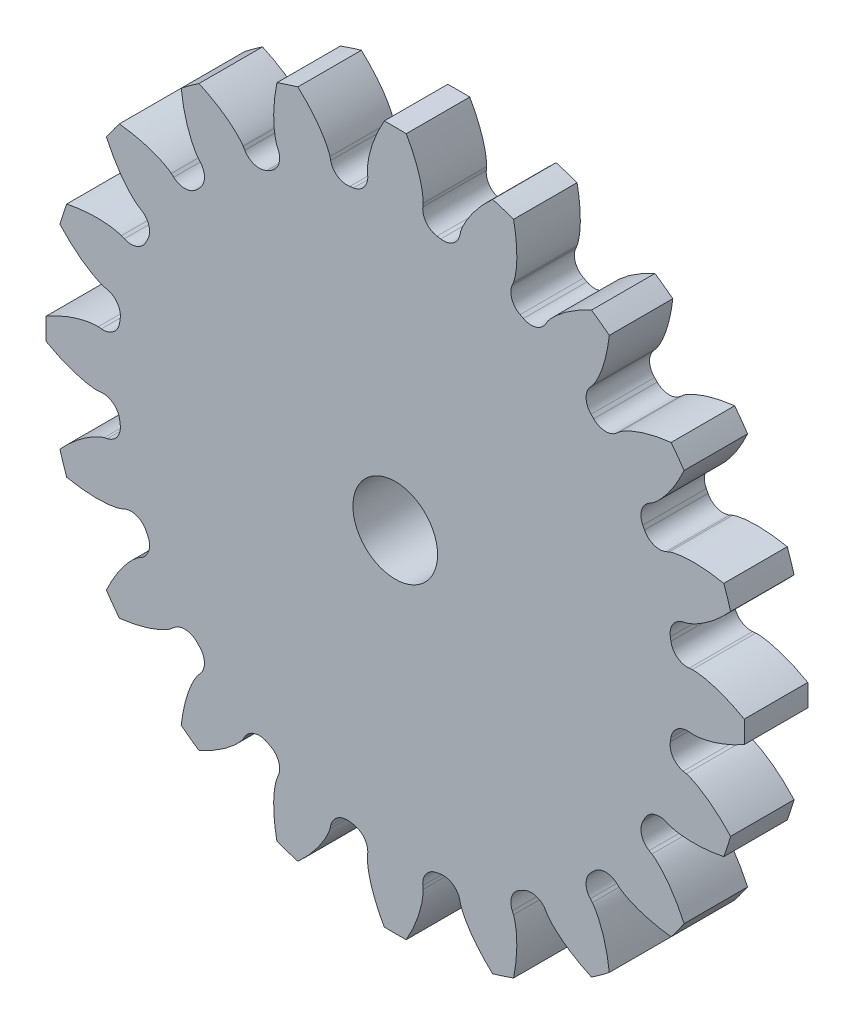
from build123d import *

# Parameters (mm, degrees)
MODEL_R             = 4
BOSS_EXTRUDE2_DEPTH = 6


with BuildPart() as part:
    # Model → Boss-Extrude2 (new body)
    with BuildSketch(Plane.XY):
        with BuildLine():
            Line((-84.452138653, -56.223110333), (-84.750868732, -56.195265408))
            add(Edge.make_bspline(
                [(-84.750868732, -56.195265408), (-84.807388971, -56.189997101), (-84.878171082, -56.187165802), (-84.97749677, -56.189774636), (-85.105456421, -56.199125992), (-85.247774812, -56.211824486), (-85.390138694, -56.225824227), (-85.532553268, -56.243563632), (-85.703479572, -56.270452137), (-85.8743758, -56.30201346), (-86.073628719, -56.342667596), (-86.272741411, -56.387735617), (-86.485825478, -56.442323656), (-86.698640566, -56.501203027), (-86.967743567, -56.582103266), (-87.264462039, -56.680220886), (-87.574402529, -56.791676392), (-87.939269143, -56.935274203), (-88.316339882, -57.097021076), (-88.677605084, -57.264039345), (-89.023040593, -57.43493046), (-89.297827849, -57.57929238), (-89.489341469, -57.683940542), (-89.612118739, -57.752699217), (-89.666619251, -57.783551514)],
                knots=[0, 0, 0, 0, 0, 0, 0.057142857, 0.071428571, 0.1, 0.128571429, 0.142857143, 0.2, 0.214285714, 0.271428571, 0.3, 0.342857143, 0.4, 0.428571429, 0.485714286, 0.571428571, 0.642857143, 0.714285714, 0.8, 0.871428571, 0.942857143, 1, 1, 1, 1, 1, 1], degree=5, weights=[1, 1, 1, 1, 1, 1, 1, 1, 1, 1, 1, 1, 1, 1, 1, 1, 1, 1, 1, 1, 1, 1, 1, 1, 1]))
            ThreePointArc((-89.666619251, -57.783551514), (-89.683078958, -58.825698189), (-89.666619251, -59.867844865))
            add(Edge.make_bspline(
                [(-89.666619251, -59.867844865), (-89.489492585, -59.968114829), (-89.256937719, -60.095191607), (-88.968129212, -60.24564973), (-88.608464147, -60.42142544), (-88.176770669, -60.614848152), (-87.869115492, -60.743856254), (-87.546220816, -60.869832163), (-87.236230565, -60.980778804), (-86.967726904, -61.069082528), (-86.712822332, -61.1461933), (-86.500008365, -61.205069005), (-86.301154497, -61.256350924), (-86.130528405, -61.296191881), (-85.959775665, -61.332118143), (-85.803171666, -61.362723104), (-85.646503666, -61.390024828), (-85.504067677, -61.411826881), (-85.361662056, -61.428594375), (-85.219304588, -61.442225116), (-85.077002787, -61.45469739), (-84.949104848, -61.462741324), (-84.864008069, -61.463852021), (-84.793258911, -61.460082201), (-84.750868732, -61.456130971)],
                knots=[-1, -1, -1, -1, -1, -1, -0.814285714, -0.757142857, -0.7, -0.628571429, -0.557142857, -0.5, -0.428571429, -0.385714286, -0.357142857, -0.3, -0.285714286, -0.228571429, -0.214285714, -0.185714286, -0.142857143, -0.128571429, -0.085714286, -0.071428571, -0.042857143, 0, 0, 0, 0, 0, 0], degree=5, weights=[1, 1, 1, 1, 1, 1, 1, 1, 1, 1, 1, 1, 1, 1, 1, 1, 1, 1, 1, 1, 1, 1, 1, 1, 1]))
            Line((-84.750868732, -61.456130971), (-84.452138653, -61.428286046))
            ThreePointArc((-84.452138653, -61.428286046), (-83.326755299, -61.75850429), (-82.735203237, -62.771222384))
            ThreePointArc((-82.735203237, -62.771222384), (-82.707876582, -62.947621195), (-82.679355545, -63.123830835))
            ThreePointArc((-82.679355545, -63.123830835), (-82.929007887, -64.269782618), (-83.897268009, -64.931601413))
            Line((-83.897268009, -64.931601413), (-84.189981752, -64.997431986))
            add(Edge.make_bspline(
                [(-84.189981752, -64.997431986), (-84.245363691, -65.009887243), (-84.313556398, -65.029067393), (-84.407214566, -65.062241867), (-84.526021699, -65.110677242), (-84.657450482, -65.166733029), (-84.788520421, -65.224040433), (-84.918482952, -65.284920134), (-85.072734523, -65.363311754), (-85.225513508, -65.446138195), (-85.402451476, -65.546375114), (-85.577892115, -65.650766554), (-85.763678474, -65.768529462), (-85.947882924, -65.890290551), (-86.178815538, -66.050388651), (-86.430691562, -66.235395103), (-86.691020839, -66.437172467), (-86.993655446, -66.686492085), (-87.302288497, -66.95684377), (-87.594260638, -67.227324669), (-87.869981072, -67.496597221), (-88.086708995, -67.718807497), (-88.23651121, -67.877514777), (-88.332031734, -67.980848426), (-88.374330918, -68.027032288)],
                knots=[0, 0, 0, 0, 0, 0, 0.057142857, 0.071428571, 0.1, 0.128571429, 0.142857143, 0.2, 0.214285714, 0.271428571, 0.3, 0.342857143, 0.4, 0.428571429, 0.485714286, 0.571428571, 0.642857143, 0.714285714, 0.8, 0.871428571, 0.942857143, 1, 1, 1, 1, 1, 1], degree=5, weights=[1, 1, 1, 1, 1, 1, 1, 1, 1, 1, 1, 1, 1, 1, 1, 1, 1, 1, 1, 1, 1, 1, 1, 1, 1]))
            ThreePointArc((-88.374330918, -68.027032288), (-88.067943995, -69.023259004), (-87.730248851, -70.009313061))
            add(Edge.make_bspline(
                [(-87.730248851, -70.009313061), (-87.530806258, -70.049940314), (-87.270364553, -70.098934106), (-86.949197224, -70.152781548), (-86.552817738, -70.208811565), (-86.082481938, -70.259366874), (-85.750018781, -70.286990193), (-85.403998999, -70.307020459), (-85.074896353, -70.31674473), (-84.792246845, -70.317754367), (-84.525989652, -70.312321224), (-84.305397949, -70.302552215), (-84.100429697, -70.289874994), (-83.925843108, -70.275039633), (-83.752345776, -70.256442041), (-83.593949069, -70.237155791), (-83.436512251, -70.214708199), (-83.29431037, -70.191428042), (-83.153693135, -70.16336912), (-83.014091007, -70.132341848), (-82.874899807, -70.100230011), (-82.750775927, -70.06835761), (-82.669500857, -70.043117595), (-82.603379347, -70.017669591), (-82.564284888, -70.000812461)],
                knots=[-1, -1, -1, -1, -1, -1, -0.814285714, -0.757142857, -0.7, -0.628571429, -0.557142857, -0.5, -0.428571429, -0.385714286, -0.357142857, -0.3, -0.285714286, -0.228571429, -0.214285714, -0.185714286, -0.142857143, -0.128571429, -0.085714286, -0.071428571, -0.042857143, 0, 0, 0, 0, 0, 0], degree=5, weights=[1, 1, 1, 1, 1, 1, 1, 1, 1, 1, 1, 1, 1, 1, 1, 1, 1, 1, 1, 1, 1, 1, 1, 1, 1]))
            Line((-82.564284888, -70.000812461), (-82.288780255, -69.882017693))
            ThreePointArc((-82.288780255, -69.882017693), (-81.116434034, -69.848311324), (-80.240887489, -70.628663827))
            ThreePointArc((-80.240887489, -70.628663827), (-80.160388065, -70.787984665), (-80.078811174, -70.946756506))
            ThreePointArc((-80.078811174, -70.946756506), (-79.962126084, -72.113768233), (-80.678482929, -73.042404143))
            Line((-80.678482929, -73.042404143), (-80.936527475, -73.19546626))
            add(Edge.make_bspline(
                [(-80.936527475, -73.19546626), (-80.985349943, -73.224425873), (-81.044278069, -73.263739985), (-81.123100804, -73.324232751), (-81.221125748, -73.407010953), (-81.328799758, -73.500936902), (-81.435745716, -73.595942321), (-81.540534566, -73.694002987), (-81.663012184, -73.816224205), (-81.782718856, -73.942208134), (-81.920021952, -74.092215949), (-82.054617185, -74.245712247), (-82.194919773, -74.41512257), (-82.33248237, -74.587846552), (-82.502639303, -74.811470996), (-82.685017499, -75.06525656), (-82.87025272, -75.337604407), (-83.081031336, -75.668240692), (-83.291015546, -76.020733281), (-83.485114359, -76.368200255), (-83.664130279, -76.709495971), (-83.801584031, -76.987803113), (-83.895011158, -77.185034136), (-83.953924721, -77.312827741), (-83.979882037, -77.369822371)],
                knots=[0, 0, 0, 0, 0, 0, 0.057142857, 0.071428571, 0.1, 0.128571429, 0.142857143, 0.2, 0.214285714, 0.271428571, 0.3, 0.342857143, 0.4, 0.428571429, 0.485714286, 0.571428571, 0.642857143, 0.714285714, 0.8, 0.871428571, 0.942857143, 1, 1, 1, 1, 1, 1], degree=5, weights=[1, 1, 1, 1, 1, 1, 1, 1, 1, 1, 1, 1, 1, 1, 1, 1, 1, 1, 1, 1, 1, 1, 1, 1, 1]))
            ThreePointArc((-83.979882037, -77.369822371), (-83.380639772, -78.222611515), (-82.754765144, -79.056051113))
            add(Edge.make_bspline(
                [(-82.754765144, -79.056051113), (-82.552529454, -79.033058776), (-82.289694759, -78.999173729), (-81.967606703, -78.951139526), (-81.573313183, -78.881939241), (-81.110374805, -78.784678442), (-80.785647479, -78.708213014), (-80.450373418, -78.620336936), (-80.134373237, -78.527886957), (-79.865245586, -78.441503678), (-79.61369888, -78.354058455), (-79.406922494, -78.276600989), (-79.215903579, -78.201205562), (-79.054446244, -78.133146073), (-78.895187448, -78.061845087), (-78.750503007, -77.9945555), (-78.607708382, -77.924555919), (-78.479660321, -77.858472376), (-78.354596067, -77.78833364), (-78.231414508, -77.715685521), (-78.108958913, -77.642132902), (-78.000759203, -77.573464059), (-77.93126161, -77.524344001), (-77.876240184, -77.47970884), (-77.844268283, -77.451595905)],
                knots=[-1, -1, -1, -1, -1, -1, -0.814285714, -0.757142857, -0.7, -0.628571429, -0.557142857, -0.5, -0.428571429, -0.385714286, -0.357142857, -0.3, -0.285714286, -0.228571429, -0.214285714, -0.185714286, -0.142857143, -0.128571429, -0.085714286, -0.071428571, -0.042857143, 0, 0, 0, 0, 0, 0], degree=5, weights=[1, 1, 1, 1, 1, 1, 1, 1, 1, 1, 1, 1, 1, 1, 1, 1, 1, 1, 1, 1, 1, 1, 1, 1, 1]))
            Line((-77.844268283, -77.451595905), (-77.618957409, -77.253479753))
            ThreePointArc((-77.618957409, -77.253479753), (-76.514405737, -76.859148186), (-75.440569305, -77.330748757))
            ThreePointArc((-75.440569305, -77.330748757), (-75.314776957, -77.457396188), (-75.188129525, -77.583188536))
            ThreePointArc((-75.188129525, -77.583188536), (-74.716528955, -78.657024968), (-75.110860522, -79.76157664))
            Line((-75.110860522, -79.76157664), (-75.308976674, -79.986887515))
            add(Edge.make_bspline(
                [(-75.308976674, -79.986887515), (-75.346460587, -80.029516716), (-75.390355837, -80.08511645), (-75.44662742, -80.167006054), (-75.514274811, -80.276024176), (-75.587654165, -80.398626161), (-75.660007526, -80.522029802), (-75.729365232, -80.647672573), (-75.808079936, -80.801759525), (-75.882996571, -80.958568757), (-75.967224611, -81.143663657), (-76.04779932, -81.331239526), (-76.128884341, -81.535714202), (-76.2063395, -81.74249365), (-76.299064607, -82.007754519), (-76.394092526, -82.305476895), (-76.486101577, -82.621735922), (-76.584391723, -83.001323889), (-76.675172373, -83.401452952), (-76.752398113, -83.791893514), (-76.817186195, -84.17180399), (-76.861910845, -84.478965356), (-76.889817584, -84.695413776), (-76.906357316, -84.835158009), (-76.913431882, -84.897384375)],
                knots=[0, 0, 0, 0, 0, 0, 0.057142857, 0.071428571, 0.1, 0.128571429, 0.142857143, 0.2, 0.214285714, 0.271428571, 0.3, 0.342857143, 0.4, 0.428571429, 0.485714286, 0.571428571, 0.642857143, 0.714285714, 0.8, 0.871428571, 0.942857143, 1, 1, 1, 1, 1, 1], degree=5, weights=[1, 1, 1, 1, 1, 1, 1, 1, 1, 1, 1, 1, 1, 1, 1, 1, 1, 1, 1, 1, 1, 1, 1, 1, 1]))
            ThreePointArc((-76.913431882, -84.897384375), (-76.079992283, -85.523259004), (-75.22720314, -86.122501268))
            add(Edge.make_bspline(
                [(-75.22720314, -86.122501268), (-75.041970593, -86.038139991), (-74.802470999, -85.924693008), (-74.510990439, -85.779479084), (-74.157379081, -85.591822304), (-73.74715376, -85.356265961), (-73.461948837, -85.183196755), (-73.170239458, -84.996016256), (-72.898274042, -84.810441674), (-72.669012337, -84.645121276), (-72.456799264, -84.48422372), (-72.284078907, -84.346659875), (-72.125707591, -84.215926472), (-71.99318408, -84.101304991), (-71.86375318, -83.984280049), (-71.746943726, -83.875573898), (-71.632769027, -83.764874374), (-71.531409022, -83.662456163), (-71.43413991, -83.557103281), (-71.339436789, -83.449945619), (-71.245703607, -83.342152062), (-71.164019406, -83.243408562), (-71.113102201, -83.175216673), (-71.074566738, -83.115763558), (-71.052847028, -83.079146707)],
                knots=[-1, -1, -1, -1, -1, -1, -0.814285714, -0.757142857, -0.7, -0.628571429, -0.557142857, -0.5, -0.428571429, -0.385714286, -0.357142857, -0.3, -0.285714286, -0.228571429, -0.214285714, -0.185714286, -0.142857143, -0.128571429, -0.085714286, -0.071428571, -0.042857143, 0, 0, 0, 0, 0, 0], degree=5, weights=[1, 1, 1, 1, 1, 1, 1, 1, 1, 1, 1, 1, 1, 1, 1, 1, 1, 1, 1, 1, 1, 1, 1, 1, 1]))
            Line((-71.052847028, -83.079146707), (-70.899784911, -82.82110216))
            ThreePointArc((-70.899784911, -82.82110216), (-69.971149002, -82.104745316), (-68.804137275, -82.221430405))
            ThreePointArc((-68.804137275, -82.221430405), (-68.645365433, -82.303007296), (-68.486044595, -82.38350672))
            ThreePointArc((-68.486044595, -82.38350672), (-67.705692093, -83.259053266), (-67.739398461, -84.431399487))
            Line((-67.739398461, -84.431399487), (-67.85819323, -84.70690412))
            add(Edge.make_bspline(
                [(-67.85819323, -84.70690412), (-67.880669402, -84.759030065), (-67.905235003, -84.825472933), (-67.933447179, -84.92074345), (-67.964095218, -85.045330039), (-67.995997034, -85.184606922), (-68.026675348, -85.324329178), (-68.053812695, -85.465255264), (-68.08105934, -85.636124844), (-68.103852576, -85.8084098), (-68.126760734, -86.010473406), (-68.145427704, -86.213767614), (-68.159357992, -86.433291236), (-68.169123862, -86.653885138), (-68.175340562, -86.93481685), (-68.173716211, -87.247332898), (-68.163492604, -87.576545466), (-68.139672955, -87.967928401), (-68.102363804, -88.376526517), (-68.055157078, -88.771721625), (-67.999375412, -89.153058576), (-67.946992999, -89.459007072), (-67.906647646, -89.673485409), (-67.879194523, -89.811501131), (-67.86669383, -89.872868083)],
                knots=[0, 0, 0, 0, 0, 0, 0.057142857, 0.071428571, 0.1, 0.128571429, 0.142857143, 0.2, 0.214285714, 0.271428571, 0.3, 0.342857143, 0.4, 0.428571429, 0.485714286, 0.571428571, 0.642857143, 0.714285714, 0.8, 0.871428571, 0.942857143, 1, 1, 1, 1, 1, 1], degree=5, weights=[1, 1, 1, 1, 1, 1, 1, 1, 1, 1, 1, 1, 1, 1, 1, 1, 1, 1, 1, 1, 1, 1, 1, 1, 1]))
            ThreePointArc((-67.86669383, -89.872868083), (-66.880639772, -90.210563227), (-65.884413057, -90.516950149))
            add(Edge.make_bspline(
                [(-65.884413057, -90.516950149), (-65.734315504, -90.379477802), (-65.5415949, -90.197573865), (-65.309253985, -89.96939477), (-65.030938733, -89.681650647), (-64.713582181, -89.330856657), (-64.495817507, -89.078124892), (-64.276227356, -88.809962504), (-64.074918574, -88.549428653), (-63.907964548, -88.321353848), (-63.755858001, -88.102753733), (-63.634100746, -87.918549216), (-63.523879518, -87.745274933), (-63.433262154, -87.59531141), (-63.34632875, -87.444017729), (-63.268828405, -87.304535928), (-63.194449848, -87.163972503), (-63.129699723, -87.035245032), (-63.06974713, -86.904990679), (-63.012792649, -86.773812812), (-62.956957136, -86.642329901), (-62.909784264, -86.523177446), (-62.882431577, -86.442588824), (-62.864154197, -86.374137438), (-62.854812755, -86.332600984)],
                knots=[-1, -1, -1, -1, -1, -1, -0.814285714, -0.757142857, -0.7, -0.628571429, -0.557142857, -0.5, -0.428571429, -0.385714286, -0.357142857, -0.3, -0.285714286, -0.228571429, -0.214285714, -0.185714286, -0.142857143, -0.128571429, -0.085714286, -0.071428571, -0.042857143, 0, 0, 0, 0, 0, 0], degree=5, weights=[1, 1, 1, 1, 1, 1, 1, 1, 1, 1, 1, 1, 1, 1, 1, 1, 1, 1, 1, 1, 1, 1, 1, 1, 1]))
            Line((-62.854812755, -86.332600984), (-62.788982181, -86.03988724))
            ThreePointArc((-62.788982181, -86.03988724), (-62.127163387, -85.071627118), (-60.981211604, -84.821974776))
            ThreePointArc((-60.981211604, -84.821974776), (-60.805001964, -84.850495813), (-60.628603153, -84.877822469))
            ThreePointArc((-60.628603153, -84.877822469), (-59.615885058, -85.469374531), (-59.285666814, -86.594757884))
            Line((-59.285666814, -86.594757884), (-59.313511739, -86.893487963))
            add(Edge.make_bspline(
                [(-59.313511739, -86.893487963), (-59.318780046, -86.950008203), (-59.321611345, -87.020790313), (-59.319002511, -87.120116001), (-59.309651155, -87.248075653), (-59.296952661, -87.390394044), (-59.28295292, -87.532757926), (-59.265213515, -87.6751725), (-59.23832501, -87.846098804), (-59.206763687, -88.016995031), (-59.166109551, -88.216247951), (-59.12104153, -88.415360642), (-59.066453491, -88.628444709), (-59.00757412, -88.841259797), (-58.926673881, -89.110362799), (-58.828556261, -89.40708127), (-58.717100755, -89.71702176), (-58.573502944, -90.081888374), (-58.411756071, -90.458959114), (-58.244737802, -90.820224315), (-58.073846687, -91.165659825), (-57.929484767, -91.44044708), (-57.824836605, -91.6319607), (-57.75607793, -91.75473797), (-57.725225633, -91.809238483)],
                knots=[0, 0, 0, 0, 0, 0, 0.057142857, 0.071428571, 0.1, 0.128571429, 0.142857143, 0.2, 0.214285714, 0.271428571, 0.3, 0.342857143, 0.4, 0.428571429, 0.485714286, 0.571428571, 0.642857143, 0.714285714, 0.8, 0.871428571, 0.942857143, 1, 1, 1, 1, 1, 1], degree=5, weights=[1, 1, 1, 1, 1, 1, 1, 1, 1, 1, 1, 1, 1, 1, 1, 1, 1, 1, 1, 1, 1, 1, 1, 1, 1]))
            ThreePointArc((-57.725225633, -91.809238483), (-56.683078958, -91.825698189), (-55.640932282, -91.809238483))
            add(Edge.make_bspline(
                [(-55.640932282, -91.809238483), (-55.540662318, -91.632111817), (-55.41358554, -91.399556951), (-55.263127417, -91.110748444), (-55.087351707, -90.751083378), (-54.893928995, -90.3193899), (-54.764920893, -90.011734723), (-54.638944984, -89.688840048), (-54.527998343, -89.378849797), (-54.439694619, -89.110346136), (-54.362583847, -88.855441564), (-54.303708142, -88.642627597), (-54.252426223, -88.443773728), (-54.212585266, -88.273147637), (-54.176659004, -88.102394896), (-54.146054043, -87.945790897), (-54.118752319, -87.789122898), (-54.096950266, -87.646686908), (-54.080182772, -87.504281287), (-54.066552031, -87.361923819), (-54.054079757, -87.219622018), (-54.046035823, -87.09172408), (-54.044925126, -87.006627301), (-54.048694946, -86.935878143), (-54.052646176, -86.893487963)],
                knots=[-1, -1, -1, -1, -1, -1, -0.814285714, -0.757142857, -0.7, -0.628571429, -0.557142857, -0.5, -0.428571429, -0.385714286, -0.357142857, -0.3, -0.285714286, -0.228571429, -0.214285714, -0.185714286, -0.142857143, -0.128571429, -0.085714286, -0.071428571, -0.042857143, 0, 0, 0, 0, 0, 0], degree=5, weights=[1, 1, 1, 1, 1, 1, 1, 1, 1, 1, 1, 1, 1, 1, 1, 1, 1, 1, 1, 1, 1, 1, 1, 1, 1]))
            Line((-54.052646176, -86.893487963), (-54.080491101, -86.594757884))
            ThreePointArc((-54.080491101, -86.594757884), (-53.750272857, -85.469374531), (-52.737554763, -84.877822469))
            ThreePointArc((-52.737554763, -84.877822469), (-52.561155952, -84.850495813), (-52.384946312, -84.821974776))
            ThreePointArc((-52.384946312, -84.821974776), (-51.238994529, -85.071627118), (-50.577175734, -86.03988724))
            Line((-50.577175734, -86.03988724), (-50.511345161, -86.332600984))
            add(Edge.make_bspline(
                [(-50.511345161, -86.332600984), (-50.498889904, -86.387982922), (-50.479709754, -86.456175629), (-50.446535279, -86.549833798), (-50.398099905, -86.668640931), (-50.342044118, -86.800069713), (-50.284736714, -86.931139653), (-50.223857013, -87.061102184), (-50.145465393, -87.215353754), (-50.062638952, -87.36813274), (-49.962402033, -87.545070708), (-49.858010592, -87.720511346), (-49.740247685, -87.906297705), (-49.618486596, -88.090502155), (-49.458388496, -88.321434769), (-49.273382044, -88.573310793), (-49.07160468, -88.83364007), (-48.822285062, -89.136274677), (-48.551933377, -89.444907729), (-48.281452478, -89.736879869), (-48.012179926, -90.012600303), (-47.78996965, -90.229328226), (-47.63126237, -90.379130442), (-47.527928721, -90.474650966), (-47.481744859, -90.516950149)],
                knots=[0, 0, 0, 0, 0, 0, 0.057142857, 0.071428571, 0.1, 0.128571429, 0.142857143, 0.2, 0.214285714, 0.271428571, 0.3, 0.342857143, 0.4, 0.428571429, 0.485714286, 0.571428571, 0.642857143, 0.714285714, 0.8, 0.871428571, 0.942857143, 1, 1, 1, 1, 1, 1], degree=5, weights=[1, 1, 1, 1, 1, 1, 1, 1, 1, 1, 1, 1, 1, 1, 1, 1, 1, 1, 1, 1, 1, 1, 1, 1, 1]))
            ThreePointArc((-47.481744859, -90.516950149), (-46.485518143, -90.210563227), (-45.499464086, -89.872868083))
            add(Edge.make_bspline(
                [(-45.499464086, -89.872868083), (-45.458836833, -89.67342549), (-45.409843041, -89.412983785), (-45.355995599, -89.091816455), (-45.299965582, -88.695436969), (-45.249410273, -88.225101169), (-45.221786954, -87.892638012), (-45.201756688, -87.54661823), (-45.192032417, -87.217515585), (-45.19102278, -86.934866077), (-45.196455923, -86.668608884), (-45.206224932, -86.44801718), (-45.218902153, -86.243048929), (-45.233737514, -86.068462339), (-45.252335106, -85.894965007), (-45.271621356, -85.7365683), (-45.294068948, -85.579131482), (-45.317349105, -85.436929601), (-45.345408027, -85.296312366), (-45.376435299, -85.156710238), (-45.408547136, -85.017519038), (-45.440419537, -84.893395159), (-45.465659552, -84.812120088), (-45.491107556, -84.745998579), (-45.507964686, -84.70690412)],
                knots=[-1, -1, -1, -1, -1, -1, -0.814285714, -0.757142857, -0.7, -0.628571429, -0.557142857, -0.5, -0.428571429, -0.385714286, -0.357142857, -0.3, -0.285714286, -0.228571429, -0.214285714, -0.185714286, -0.142857143, -0.128571429, -0.085714286, -0.071428571, -0.042857143, 0, 0, 0, 0, 0, 0], degree=5, weights=[1, 1, 1, 1, 1, 1, 1, 1, 1, 1, 1, 1, 1, 1, 1, 1, 1, 1, 1, 1, 1, 1, 1, 1, 1]))
            Line((-45.507964686, -84.70690412), (-45.626759454, -84.431399487))
            ThreePointArc((-45.626759454, -84.431399487), (-45.660465823, -83.259053266), (-44.88011332, -82.38350672))
            ThreePointArc((-44.88011332, -82.38350672), (-44.720792482, -82.303007296), (-44.562020641, -82.221430405))
            ThreePointArc((-44.562020641, -82.221430405), (-43.395008914, -82.104745316), (-42.466373004, -82.82110216))
            Line((-42.466373004, -82.82110216), (-42.313310887, -83.079146707))
            add(Edge.make_bspline(
                [(-42.313310887, -83.079146707), (-42.284351274, -83.127969174), (-42.245037162, -83.186897301), (-42.184544396, -83.265720036), (-42.101766194, -83.36374498), (-42.007840245, -83.471418989), (-41.912834826, -83.578364947), (-41.81477416, -83.683153797), (-41.692552942, -83.805631416), (-41.566569013, -83.925338087), (-41.416561198, -84.062641184), (-41.2630649, -84.197236417), (-41.093654577, -84.337539004), (-40.920930595, -84.475101601), (-40.697306151, -84.645258535), (-40.443520587, -84.827636731), (-40.17117274, -85.012871952), (-39.840536455, -85.223650568), (-39.488043866, -85.433634777), (-39.140576892, -85.62773359), (-38.799281176, -85.80674951), (-38.520974034, -85.944203262), (-38.323743011, -86.037630389), (-38.195949406, -86.096543952), (-38.138954776, -86.122501268)],
                knots=[0, 0, 0, 0, 0, 0, 0.057142857, 0.071428571, 0.1, 0.128571429, 0.142857143, 0.2, 0.214285714, 0.271428571, 0.3, 0.342857143, 0.4, 0.428571429, 0.485714286, 0.571428571, 0.642857143, 0.714285714, 0.8, 0.871428571, 0.942857143, 1, 1, 1, 1, 1, 1], degree=5, weights=[1, 1, 1, 1, 1, 1, 1, 1, 1, 1, 1, 1, 1, 1, 1, 1, 1, 1, 1, 1, 1, 1, 1, 1, 1]))
            ThreePointArc((-38.138954776, -86.122501268), (-37.286165632, -85.523259004), (-36.452726034, -84.897384375))
            add(Edge.make_bspline(
                [(-36.452726034, -84.897384375), (-36.475718371, -84.695148686), (-36.509603418, -84.432313991), (-36.557637621, -84.110225934), (-36.626837906, -83.715932414), (-36.724098705, -83.252994037), (-36.800564133, -82.92826671), (-36.888440211, -82.592992649), (-36.98089019, -82.276992468), (-37.067273469, -82.007864817), (-37.154718692, -81.756318112), (-37.232176158, -81.549541725), (-37.307571585, -81.35852281), (-37.375631074, -81.197065475), (-37.44693206, -81.03780668), (-37.514221647, -80.893122238), (-37.584221228, -80.750327613), (-37.650304771, -80.622279552), (-37.720443507, -80.497215298), (-37.793091626, -80.374033739), (-37.866644245, -80.251578145), (-37.935313088, -80.143378434), (-37.984433146, -80.073880842), (-38.029068307, -80.018859415), (-38.057181242, -79.986887515)],
                knots=[-1, -1, -1, -1, -1, -1, -0.814285714, -0.757142857, -0.7, -0.628571429, -0.557142857, -0.5, -0.428571429, -0.385714286, -0.357142857, -0.3, -0.285714286, -0.228571429, -0.214285714, -0.185714286, -0.142857143, -0.128571429, -0.085714286, -0.071428571, -0.042857143, 0, 0, 0, 0, 0, 0], degree=5, weights=[1, 1, 1, 1, 1, 1, 1, 1, 1, 1, 1, 1, 1, 1, 1, 1, 1, 1, 1, 1, 1, 1, 1, 1, 1]))
            Line((-38.057181242, -79.986887515), (-38.255297394, -79.76157664))
            ThreePointArc((-38.255297394, -79.76157664), (-38.649628961, -78.657024968), (-38.17802839, -77.583188536))
            ThreePointArc((-38.17802839, -77.583188536), (-38.051380959, -77.457396188), (-37.925588611, -77.330748757))
            ThreePointArc((-37.925588611, -77.330748757), (-36.851752179, -76.859148186), (-35.747200506, -77.253479753))
            Line((-35.747200506, -77.253479753), (-35.521889632, -77.451595905))
            add(Edge.make_bspline(
                [(-35.521889632, -77.451595905), (-35.479260431, -77.489079819), (-35.423660696, -77.532975069), (-35.341771093, -77.589246652), (-35.232752971, -77.656894042), (-35.110150986, -77.730273396), (-34.986747345, -77.802626757), (-34.861104574, -77.871984464), (-34.707017622, -77.950699167), (-34.55020839, -78.025615803), (-34.36511349, -78.109843843), (-34.177537621, -78.190418552), (-33.973062945, -78.271503573), (-33.766283497, -78.348958731), (-33.501022628, -78.441683838), (-33.203300251, -78.536711758), (-32.887041225, -78.628720809), (-32.507453258, -78.727010954), (-32.107324195, -78.817791605), (-31.716883633, -78.895017345), (-31.336973157, -78.959805426), (-31.029811791, -79.004530076), (-30.813363371, -79.032436816), (-30.673619138, -79.048976548), (-30.611392772, -79.056051113)],
                knots=[0, 0, 0, 0, 0, 0, 0.057142857, 0.071428571, 0.1, 0.128571429, 0.142857143, 0.2, 0.214285714, 0.271428571, 0.3, 0.342857143, 0.4, 0.428571429, 0.485714286, 0.571428571, 0.642857143, 0.714285714, 0.8, 0.871428571, 0.942857143, 1, 1, 1, 1, 1, 1], degree=5, weights=[1, 1, 1, 1, 1, 1, 1, 1, 1, 1, 1, 1, 1, 1, 1, 1, 1, 1, 1, 1, 1, 1, 1, 1, 1]))
            ThreePointArc((-30.611392772, -79.056051113), (-29.985518143, -78.222611515), (-29.386275879, -77.369822371))
            add(Edge.make_bspline(
                [(-29.386275879, -77.369822371), (-29.470637156, -77.184589824), (-29.584084139, -76.94509023), (-29.729298063, -76.65360967), (-29.916954843, -76.299998313), (-30.152511186, -75.889772992), (-30.325580392, -75.604568069), (-30.512760891, -75.31285869), (-30.698335473, -75.040893273), (-30.863655871, -74.811631568), (-31.024553427, -74.599418495), (-31.162117272, -74.426698138), (-31.292850675, -74.268326823), (-31.407472156, -74.135803311), (-31.524497098, -74.006372412), (-31.633203249, -73.889562957), (-31.743902773, -73.775388259), (-31.846320984, -73.674028254), (-31.951673866, -73.576759142), (-32.058831528, -73.482056021), (-32.166625085, -73.388322839), (-32.265368585, -73.306638638), (-32.333560474, -73.255721433), (-32.393013589, -73.21718597), (-32.42963044, -73.19546626)],
                knots=[-1, -1, -1, -1, -1, -1, -0.814285714, -0.757142857, -0.7, -0.628571429, -0.557142857, -0.5, -0.428571429, -0.385714286, -0.357142857, -0.3, -0.285714286, -0.228571429, -0.214285714, -0.185714286, -0.142857143, -0.128571429, -0.085714286, -0.071428571, -0.042857143, 0, 0, 0, 0, 0, 0], degree=5, weights=[1, 1, 1, 1, 1, 1, 1, 1, 1, 1, 1, 1, 1, 1, 1, 1, 1, 1, 1, 1, 1, 1, 1, 1, 1]))
            Line((-32.42963044, -73.19546626), (-32.687674987, -73.042404143))
            ThreePointArc((-32.687674987, -73.042404143), (-33.404031831, -72.113768233), (-33.287346742, -70.946756506))
            ThreePointArc((-33.287346742, -70.946756506), (-33.205769851, -70.787984665), (-33.125270427, -70.628663827))
            ThreePointArc((-33.125270427, -70.628663827), (-32.249723881, -69.848311324), (-31.07737766, -69.882017693))
            Line((-31.07737766, -69.882017693), (-30.801873027, -70.000812461))
            add(Edge.make_bspline(
                [(-30.801873027, -70.000812461), (-30.749747082, -70.023288634), (-30.683304213, -70.047854234), (-30.588033697, -70.076066411), (-30.463447108, -70.10671445), (-30.324170225, -70.138616266), (-30.184447969, -70.169294579), (-30.043521883, -70.196431926), (-29.872652303, -70.223678571), (-29.700367347, -70.246471808), (-29.498303741, -70.269379965), (-29.295009533, -70.288046935), (-29.075485911, -70.301977224), (-28.854892009, -70.311743093), (-28.573960297, -70.317959794), (-28.261444249, -70.316335442), (-27.932231681, -70.306111836), (-27.540848746, -70.282292186), (-27.13225063, -70.244983035), (-26.737055522, -70.197776309), (-26.355718571, -70.141994643), (-26.049770075, -70.089612231), (-25.835291738, -70.049266877), (-25.697276016, -70.021813754), (-25.635909064, -70.009313061)],
                knots=[0, 0, 0, 0, 0, 0, 0.057142857, 0.071428571, 0.1, 0.128571429, 0.142857143, 0.2, 0.214285714, 0.271428571, 0.3, 0.342857143, 0.4, 0.428571429, 0.485714286, 0.571428571, 0.642857143, 0.714285714, 0.8, 0.871428571, 0.942857143, 1, 1, 1, 1, 1, 1], degree=5, weights=[1, 1, 1, 1, 1, 1, 1, 1, 1, 1, 1, 1, 1, 1, 1, 1, 1, 1, 1, 1, 1, 1, 1, 1, 1]))
            ThreePointArc((-25.635909064, -70.009313061), (-25.29821392, -69.023259004), (-24.991826998, -68.027032288))
            add(Edge.make_bspline(
                [(-24.991826998, -68.027032288), (-25.129299345, -67.876934735), (-25.311203282, -67.684214131), (-25.539382377, -67.451873216), (-25.8271265, -67.173557964), (-26.17792049, -66.856201413), (-26.430652255, -66.638436738), (-26.698814643, -66.418846588), (-26.959348494, -66.217537806), (-27.187423299, -66.05058378), (-27.406023414, -65.898477233), (-27.590227931, -65.776719978), (-27.763502214, -65.666498749), (-27.913465737, -65.575881386), (-28.064759418, -65.488947981), (-28.204241219, -65.411447636), (-28.344804644, -65.33706908), (-28.473532115, -65.272318954), (-28.603786468, -65.212366362), (-28.734964335, -65.15541188), (-28.866447246, -65.099576368), (-28.985599701, -65.052403496), (-29.066188323, -65.025050809), (-29.134639709, -65.006773429), (-29.176176163, -64.997431986)],
                knots=[-1, -1, -1, -1, -1, -1, -0.814285714, -0.757142857, -0.7, -0.628571429, -0.557142857, -0.5, -0.428571429, -0.385714286, -0.357142857, -0.3, -0.285714286, -0.228571429, -0.214285714, -0.185714286, -0.142857143, -0.128571429, -0.085714286, -0.071428571, -0.042857143, 0, 0, 0, 0, 0, 0], degree=5, weights=[1, 1, 1, 1, 1, 1, 1, 1, 1, 1, 1, 1, 1, 1, 1, 1, 1, 1, 1, 1, 1, 1, 1, 1, 1]))
            Line((-29.176176163, -64.997431986), (-29.468889907, -64.931601413))
            ThreePointArc((-29.468889907, -64.931601413), (-30.437150029, -64.269782618), (-30.686802371, -63.123830835))
            ThreePointArc((-30.686802371, -63.123830835), (-30.658281334, -62.947621195), (-30.630954678, -62.771222384))
            ThreePointArc((-30.630954678, -62.771222384), (-30.039402616, -61.75850429), (-28.914019263, -61.428286046))
            Line((-28.914019263, -61.428286046), (-28.615289184, -61.456130971))
            add(Edge.make_bspline(
                [(-28.615289184, -61.456130971), (-28.558768944, -61.461399278), (-28.487986834, -61.464230577), (-28.388661146, -61.461621742), (-28.260701494, -61.452270387), (-28.118383103, -61.439571893), (-27.976019221, -61.425572151), (-27.833604647, -61.407832746), (-27.662678343, -61.380944241), (-27.491782116, -61.349382918), (-27.292529196, -61.308728782), (-27.093416505, -61.263660761), (-26.880332438, -61.209072722), (-26.66751735, -61.150193352), (-26.398414348, -61.069293112), (-26.101695877, -60.971175492), (-25.791755387, -60.859719986), (-25.426888773, -60.716122175), (-25.049818033, -60.554375302), (-24.688552832, -60.387357034), (-24.343117322, -60.216465918), (-24.068330067, -60.072103998), (-23.876816447, -59.967455836), (-23.754039177, -59.898697161), (-23.699538664, -59.867844865)],
                knots=[0, 0, 0, 0, 0, 0, 0.057142857, 0.071428571, 0.1, 0.128571429, 0.142857143, 0.2, 0.214285714, 0.271428571, 0.3, 0.342857143, 0.4, 0.428571429, 0.485714286, 0.571428571, 0.642857143, 0.714285714, 0.8, 0.871428571, 0.942857143, 1, 1, 1, 1, 1, 1], degree=5, weights=[1, 1, 1, 1, 1, 1, 1, 1, 1, 1, 1, 1, 1, 1, 1, 1, 1, 1, 1, 1, 1, 1, 1, 1, 1]))
            ThreePointArc((-23.699538664, -59.867844865), (-23.683078958, -58.825698189), (-23.699538664, -57.783551514))
            add(Edge.make_bspline(
                [(-23.699538664, -57.783551514), (-23.87666533, -57.68328155), (-24.109220196, -57.556204771), (-24.398028703, -57.405746648), (-24.757693769, -57.229970938), (-25.189387247, -57.036548226), (-25.497042424, -56.907540124), (-25.819937099, -56.781564216), (-26.12992735, -56.670617574), (-26.398431011, -56.582313851), (-26.653335583, -56.505203079), (-26.86614955, -56.446327374), (-27.065003419, -56.395045455), (-27.23562951, -56.355204498), (-27.406382251, -56.319278235), (-27.56298625, -56.288673274), (-27.719654249, -56.26137155), (-27.862090239, -56.239569498), (-28.00449586, -56.222802003), (-28.146853328, -56.209171262), (-28.289155129, -56.196698988), (-28.417053067, -56.188655055), (-28.502149846, -56.187544357), (-28.572899004, -56.191314177), (-28.615289184, -56.195265408)],
                knots=[-1, -1, -1, -1, -1, -1, -0.814285714, -0.757142857, -0.7, -0.628571429, -0.557142857, -0.5, -0.428571429, -0.385714286, -0.357142857, -0.3, -0.285714286, -0.228571429, -0.214285714, -0.185714286, -0.142857143, -0.128571429, -0.085714286, -0.071428571, -0.042857143, 0, 0, 0, 0, 0, 0], degree=5, weights=[1, 1, 1, 1, 1, 1, 1, 1, 1, 1, 1, 1, 1, 1, 1, 1, 1, 1, 1, 1, 1, 1, 1, 1, 1]))
            Line((-28.615289184, -56.195265408), (-28.914019263, -56.223110333))
            ThreePointArc((-28.914019263, -56.223110333), (-30.039402616, -55.892892089), (-30.630954678, -54.880173994))
            ThreePointArc((-30.630954678, -54.880173994), (-30.658281334, -54.703775183), (-30.686802371, -54.527565543))
            ThreePointArc((-30.686802371, -54.527565543), (-30.437150029, -53.38161376), (-29.468889907, -52.719794966))
            Line((-29.468889907, -52.719794966), (-29.176176163, -52.653964392))
            add(Edge.make_bspline(
                [(-29.176176163, -52.653964392), (-29.120794225, -52.641509135), (-29.052601518, -52.622328986), (-28.958943349, -52.589154511), (-28.840136216, -52.540719136), (-28.708707434, -52.484663349), (-28.577637494, -52.427355945), (-28.447674963, -52.366476245), (-28.293423393, -52.288084624), (-28.140644407, -52.205258184), (-27.963706439, -52.105021264), (-27.788265801, -52.000629824), (-27.602479442, -51.882866916), (-27.418274992, -51.761105828), (-27.187342378, -51.601007727), (-26.935466354, -51.416001275), (-26.675137077, -51.214223911), (-26.37250247, -50.964904293), (-26.063869418, -50.694552609), (-25.771897277, -50.42407171), (-25.496176844, -50.154799157), (-25.279448921, -49.932588882), (-25.129646705, -49.773881601), (-25.034126181, -49.670547953), (-24.991826998, -49.62436409)],
                knots=[0, 0, 0, 0, 0, 0, 0.057142857, 0.071428571, 0.1, 0.128571429, 0.142857143, 0.2, 0.214285714, 0.271428571, 0.3, 0.342857143, 0.4, 0.428571429, 0.485714286, 0.571428571, 0.642857143, 0.714285714, 0.8, 0.871428571, 0.942857143, 1, 1, 1, 1, 1, 1], degree=5, weights=[1, 1, 1, 1, 1, 1, 1, 1, 1, 1, 1, 1, 1, 1, 1, 1, 1, 1, 1, 1, 1, 1, 1, 1, 1]))
            ThreePointArc((-24.991826998, -49.62436409), (-25.29821392, -48.628137375), (-25.635909064, -47.642083317))
            add(Edge.make_bspline(
                [(-25.635909064, -47.642083317), (-25.835351657, -47.601456065), (-26.095793362, -47.552462272), (-26.416960692, -47.498614831), (-26.813340178, -47.442584814), (-27.283675978, -47.392029504), (-27.616139135, -47.364406186), (-27.962158917, -47.34437592), (-28.291261562, -47.334651649), (-28.57391107, -47.333642011), (-28.840168263, -47.339075154), (-29.060759967, -47.348844164), (-29.265728218, -47.361521385), (-29.440314808, -47.376356745), (-29.61381214, -47.394954338), (-29.772208847, -47.414240587), (-29.929645665, -47.436688179), (-30.071847546, -47.459968336), (-30.212464781, -47.488027258), (-30.352066909, -47.51905453), (-30.491258109, -47.551166368), (-30.615381988, -47.583038769), (-30.696657059, -47.608278783), (-30.762778568, -47.633726788), (-30.801873027, -47.650583917)],
                knots=[-1, -1, -1, -1, -1, -1, -0.814285714, -0.757142857, -0.7, -0.628571429, -0.557142857, -0.5, -0.428571429, -0.385714286, -0.357142857, -0.3, -0.285714286, -0.228571429, -0.214285714, -0.185714286, -0.142857143, -0.128571429, -0.085714286, -0.071428571, -0.042857143, 0, 0, 0, 0, 0, 0], degree=5, weights=[1, 1, 1, 1, 1, 1, 1, 1, 1, 1, 1, 1, 1, 1, 1, 1, 1, 1, 1, 1, 1, 1, 1, 1, 1]))
            Line((-30.801873027, -47.650583917), (-31.07737766, -47.769378686))
            ThreePointArc((-31.07737766, -47.769378686), (-32.249723881, -47.803085054), (-33.125270427, -47.022732552))
            ThreePointArc((-33.125270427, -47.022732552), (-33.205769851, -46.863411713), (-33.287346742, -46.704639872))
            ThreePointArc((-33.287346742, -46.704639872), (-33.404031831, -45.537628145), (-32.687674987, -44.608992236))
            Line((-32.687674987, -44.608992236), (-32.42963044, -44.455930118))
            add(Edge.make_bspline(
                [(-32.42963044, -44.455930118), (-32.380807973, -44.426970505), (-32.321879846, -44.387656393), (-32.243057111, -44.327163627), (-32.145032167, -44.244385426), (-32.037358158, -44.150459477), (-31.9304122, -44.055454058), (-31.82562335, -43.957393391), (-31.703145731, -43.835172173), (-31.58343906, -43.709188244), (-31.446135963, -43.55918043), (-31.31154073, -43.405684131), (-31.171238143, -43.236273808), (-31.033675546, -43.063549826), (-30.863518612, -42.839925382), (-30.681140416, -42.586139819), (-30.495905195, -42.313791971), (-30.285126579, -41.983155687), (-30.07514237, -41.630663098), (-29.881043557, -41.283196123), (-29.702027637, -40.941900408), (-29.564573885, -40.663593266), (-29.471146758, -40.466362242), (-29.412233195, -40.338568637), (-29.386275879, -40.281574007)],
                knots=[0, 0, 0, 0, 0, 0, 0.057142857, 0.071428571, 0.1, 0.128571429, 0.142857143, 0.2, 0.214285714, 0.271428571, 0.3, 0.342857143, 0.4, 0.428571429, 0.485714286, 0.571428571, 0.642857143, 0.714285714, 0.8, 0.871428571, 0.942857143, 1, 1, 1, 1, 1, 1], degree=5, weights=[1, 1, 1, 1, 1, 1, 1, 1, 1, 1, 1, 1, 1, 1, 1, 1, 1, 1, 1, 1, 1, 1, 1, 1, 1]))
            ThreePointArc((-29.386275879, -40.281574007), (-29.985518143, -39.428784864), (-30.611392772, -38.595345265))
            add(Edge.make_bspline(
                [(-30.611392772, -38.595345265), (-30.813628461, -38.618337602), (-31.076463156, -38.65222265), (-31.398551213, -38.700256852), (-31.792844733, -38.769457137), (-32.25578311, -38.866717936), (-32.580510437, -38.943183364), (-32.915784498, -39.031059442), (-33.231784679, -39.123509421), (-33.50091233, -39.209892701), (-33.752459035, -39.297337924), (-33.959235422, -39.374795389), (-34.150254337, -39.450190816), (-34.311711672, -39.518250306), (-34.470970467, -39.589551291), (-34.615654909, -39.656840879), (-34.758449534, -39.72684046), (-34.886497595, -39.792924003), (-35.011561848, -39.863062738), (-35.134743408, -39.935710858), (-35.257199002, -40.009263476), (-35.365398713, -40.077932319), (-35.434896305, -40.127052378), (-35.489917732, -40.171687538), (-35.521889632, -40.199800473)],
                knots=[-1, -1, -1, -1, -1, -1, -0.814285714, -0.757142857, -0.7, -0.628571429, -0.557142857, -0.5, -0.428571429, -0.385714286, -0.357142857, -0.3, -0.285714286, -0.228571429, -0.214285714, -0.185714286, -0.142857143, -0.128571429, -0.085714286, -0.071428571, -0.042857143, 0, 0, 0, 0, 0, 0], degree=5, weights=[1, 1, 1, 1, 1, 1, 1, 1, 1, 1, 1, 1, 1, 1, 1, 1, 1, 1, 1, 1, 1, 1, 1, 1, 1]))
            Line((-35.521889632, -40.199800473), (-35.747200506, -40.397916625))
            ThreePointArc((-35.747200506, -40.397916625), (-36.851752179, -40.792248192), (-37.925588611, -40.320647621))
            ThreePointArc((-37.925588611, -40.320647621), (-38.051380959, -40.19400019), (-38.17802839, -40.068207842))
            ThreePointArc((-38.17802839, -40.068207842), (-38.649628961, -38.99437141), (-38.255297394, -37.889819738))
            Line((-38.255297394, -37.889819738), (-38.057181242, -37.664508864))
            add(Edge.make_bspline(
                [(-38.057181242, -37.664508864), (-38.019697328, -37.621879663), (-37.975802078, -37.566279928), (-37.919530495, -37.484390324), (-37.851883105, -37.375372202), (-37.778503751, -37.252770218), (-37.70615039, -37.129366576), (-37.636792683, -37.003723805), (-37.55807798, -36.849636854), (-37.483161344, -36.692827621), (-37.398933304, -36.507732722), (-37.318358595, -36.320156852), (-37.237273574, -36.115682177), (-37.159818416, -35.908902728), (-37.067093309, -35.643641859), (-36.972065389, -35.345919483), (-36.880056338, -35.029660457), (-36.781766193, -34.65007249), (-36.690985542, -34.249943427), (-36.613759802, -33.859502864), (-36.548971721, -33.479592389), (-36.504247071, -33.172431022), (-36.476340331, -32.955982602), (-36.459800599, -32.816238369), (-36.452726034, -32.754012003)],
                knots=[0, 0, 0, 0, 0, 0, 0.057142857, 0.071428571, 0.1, 0.128571429, 0.142857143, 0.2, 0.214285714, 0.271428571, 0.3, 0.342857143, 0.4, 0.428571429, 0.485714286, 0.571428571, 0.642857143, 0.714285714, 0.8, 0.871428571, 0.942857143, 1, 1, 1, 1, 1, 1], degree=5, weights=[1, 1, 1, 1, 1, 1, 1, 1, 1, 1, 1, 1, 1, 1, 1, 1, 1, 1, 1, 1, 1, 1, 1, 1, 1]))
            ThreePointArc((-36.452726034, -32.754012003), (-37.286165632, -32.128137375), (-38.138954776, -31.52889511))
            add(Edge.make_bspline(
                [(-38.138954776, -31.52889511), (-38.324187323, -31.613256387), (-38.563686917, -31.72670337), (-38.855167477, -31.871917295), (-39.208778834, -32.059574075), (-39.619004155, -32.295130417), (-39.904209078, -32.468199624), (-40.195918457, -32.655380123), (-40.467883874, -32.840954704), (-40.697145579, -33.006275103), (-40.909358652, -33.167172659), (-41.082079009, -33.304736503), (-41.240450324, -33.435469906), (-41.372973836, -33.550091388), (-41.502404735, -33.667116329), (-41.61921419, -33.775822481), (-41.733388888, -33.886522004), (-41.834748893, -33.988940215), (-41.932018005, -34.094293097), (-42.026721126, -34.201450759), (-42.120454308, -34.309244316), (-42.202138509, -34.407987816), (-42.253055714, -34.476179705), (-42.291591177, -34.535632821), (-42.313310887, -34.572249672)],
                knots=[-1, -1, -1, -1, -1, -1, -0.814285714, -0.757142857, -0.7, -0.628571429, -0.557142857, -0.5, -0.428571429, -0.385714286, -0.357142857, -0.3, -0.285714286, -0.228571429, -0.214285714, -0.185714286, -0.142857143, -0.128571429, -0.085714286, -0.071428571, -0.042857143, 0, 0, 0, 0, 0, 0], degree=5, weights=[1, 1, 1, 1, 1, 1, 1, 1, 1, 1, 1, 1, 1, 1, 1, 1, 1, 1, 1, 1, 1, 1, 1, 1, 1]))
            Line((-42.313310887, -34.572249672), (-42.466373004, -34.830294218))
            ThreePointArc((-42.466373004, -34.830294218), (-43.395008914, -35.546651063), (-44.562020641, -35.429965973))
            ThreePointArc((-44.562020641, -35.429965973), (-44.720792482, -35.348389082), (-44.88011332, -35.267889658))
            ThreePointArc((-44.88011332, -35.267889658), (-45.660465823, -34.392343113), (-45.626759454, -33.219996892))
            Line((-45.626759454, -33.219996892), (-45.507964686, -32.944492259))
            add(Edge.make_bspline(
                [(-45.507964686, -32.944492259), (-45.485488513, -32.892366313), (-45.460922913, -32.825923445), (-45.432710736, -32.730652928), (-45.402062697, -32.60606634), (-45.370160881, -32.466789456), (-45.339482568, -32.3270672), (-45.312345221, -32.186141114), (-45.285098575, -32.015271534), (-45.262305339, -31.842986578), (-45.239397182, -31.640922972), (-45.220730212, -31.437628765), (-45.206799923, -31.218105143), (-45.197034054, -30.99751124), (-45.190817353, -30.716579528), (-45.192441705, -30.40406348), (-45.202665311, -30.074850912), (-45.226484961, -29.683467977), (-45.263794112, -29.274869861), (-45.311000837, -28.879674754), (-45.366782504, -28.498337802), (-45.419164916, -28.192389306), (-45.45951027, -27.977910969), (-45.486963393, -27.839895247), (-45.499464086, -27.778528296)],
                knots=[0, 0, 0, 0, 0, 0, 0.057142857, 0.071428571, 0.1, 0.128571429, 0.142857143, 0.2, 0.214285714, 0.271428571, 0.3, 0.342857143, 0.4, 0.428571429, 0.485714286, 0.571428571, 0.642857143, 0.714285714, 0.8, 0.871428571, 0.942857143, 1, 1, 1, 1, 1, 1], degree=5, weights=[1, 1, 1, 1, 1, 1, 1, 1, 1, 1, 1, 1, 1, 1, 1, 1, 1, 1, 1, 1, 1, 1, 1, 1, 1]))
            ThreePointArc((-45.499464086, -27.778528296), (-46.485518143, -27.440833151), (-47.481744859, -27.134446229))
            add(Edge.make_bspline(
                [(-47.481744859, -27.134446229), (-47.631842412, -27.271918576), (-47.824563016, -27.453822513), (-48.056903931, -27.682001609), (-48.335219183, -27.969745731), (-48.652575734, -28.320539721), (-48.870340409, -28.573271486), (-49.089930559, -28.841433875), (-49.291239341, -29.101967725), (-49.458193367, -29.330042531), (-49.610299914, -29.548642646), (-49.732057169, -29.732847162), (-49.842278398, -29.906121445), (-49.932895761, -30.056084969), (-50.019829166, -30.207378649), (-50.097329511, -30.34686045), (-50.171708067, -30.487423875), (-50.236458193, -30.616151347), (-50.296410785, -30.7464057), (-50.353365267, -30.877583567), (-50.409200779, -31.009066477), (-50.456373651, -31.128218933), (-50.483726338, -31.208807555), (-50.502003718, -31.277258941), (-50.511345161, -31.318795395)],
                knots=[-1, -1, -1, -1, -1, -1, -0.814285714, -0.757142857, -0.7, -0.628571429, -0.557142857, -0.5, -0.428571429, -0.385714286, -0.357142857, -0.3, -0.285714286, -0.228571429, -0.214285714, -0.185714286, -0.142857143, -0.128571429, -0.085714286, -0.071428571, -0.042857143, 0, 0, 0, 0, 0, 0], degree=5, weights=[1, 1, 1, 1, 1, 1, 1, 1, 1, 1, 1, 1, 1, 1, 1, 1, 1, 1, 1, 1, 1, 1, 1, 1, 1]))
            Line((-50.511345161, -31.318795395), (-50.577175734, -31.611509138))
            ThreePointArc((-50.577175734, -31.611509138), (-51.238994529, -32.57976926), (-52.384946312, -32.829421602))
            ThreePointArc((-52.384946312, -32.829421602), (-52.561155952, -32.800900565), (-52.737554763, -32.77357391))
            ThreePointArc((-52.737554763, -32.77357391), (-53.750272857, -32.182021848), (-54.080491101, -31.056638494))
            Line((-54.080491101, -31.056638494), (-54.052646176, -30.757908415))
            add(Edge.make_bspline(
                [(-54.052646176, -30.757908415), (-54.047377869, -30.701388176), (-54.04454657, -30.630606065), (-54.047155405, -30.531280377), (-54.05650676, -30.403320725), (-54.069205254, -30.261002334), (-54.083204996, -30.118638453), (-54.100944401, -29.976223879), (-54.127832905, -29.805297575), (-54.159394229, -29.634401347), (-54.200048365, -29.435148428), (-54.245116386, -29.236035736), (-54.299704424, -29.022951669), (-54.358583795, -28.810136581), (-54.439484035, -28.54103358), (-54.537601655, -28.244315108), (-54.649057161, -27.934374618), (-54.792654972, -27.569508004), (-54.954401845, -27.192437265), (-55.121420113, -26.831172063), (-55.292311229, -26.485736553), (-55.436673148, -26.210949298), (-55.541321311, -26.019435678), (-55.610079986, -25.896658408), (-55.640932282, -25.842157896)],
                knots=[0, 0, 0, 0, 0, 0, 0.057142857, 0.071428571, 0.1, 0.128571429, 0.142857143, 0.2, 0.214285714, 0.271428571, 0.3, 0.342857143, 0.4, 0.428571429, 0.485714286, 0.571428571, 0.642857143, 0.714285714, 0.8, 0.871428571, 0.942857143, 1, 1, 1, 1, 1, 1], degree=5, weights=[1, 1, 1, 1, 1, 1, 1, 1, 1, 1, 1, 1, 1, 1, 1, 1, 1, 1, 1, 1, 1, 1, 1, 1, 1]))
            ThreePointArc((-55.640932282, -25.842157896), (-56.683078958, -25.825698189), (-57.725225633, -25.842157896))
            add(Edge.make_bspline(
                [(-57.725225633, -25.842157896), (-57.825495597, -26.019284562), (-57.952572376, -26.251839428), (-58.103030499, -26.540647935), (-58.278806209, -26.900313), (-58.47222892, -27.332006478), (-58.601237023, -27.639661655), (-58.727212931, -27.962556331), (-58.838159573, -28.272546582), (-58.926463296, -28.541050243), (-59.003574068, -28.795954815), (-59.062449773, -29.008768782), (-59.113731692, -29.20762265), (-59.153572649, -29.378248742), (-59.189498912, -29.549001482), (-59.220103873, -29.705605481), (-59.247405597, -29.862273481), (-59.269207649, -30.00470947), (-59.285975144, -30.147115091), (-59.299605885, -30.289472559), (-59.312078159, -30.43177436), (-59.320122092, -30.559672299), (-59.32123279, -30.644769078), (-59.31746297, -30.715518236), (-59.313511739, -30.757908415)],
                knots=[-1, -1, -1, -1, -1, -1, -0.814285714, -0.757142857, -0.7, -0.628571429, -0.557142857, -0.5, -0.428571429, -0.385714286, -0.357142857, -0.3, -0.285714286, -0.228571429, -0.214285714, -0.185714286, -0.142857143, -0.128571429, -0.085714286, -0.071428571, -0.042857143, 0, 0, 0, 0, 0, 0], degree=5, weights=[1, 1, 1, 1, 1, 1, 1, 1, 1, 1, 1, 1, 1, 1, 1, 1, 1, 1, 1, 1, 1, 1, 1, 1, 1]))
            Line((-59.313511739, -30.757908415), (-59.285666814, -31.056638494))
            ThreePointArc((-59.285666814, -31.056638494), (-59.615885058, -32.182021848), (-60.628603153, -32.77357391))
            ThreePointArc((-60.628603153, -32.77357391), (-60.805001964, -32.800900565), (-60.981211604, -32.829421602))
            ThreePointArc((-60.981211604, -32.829421602), (-62.127163387, -32.57976926), (-62.788982181, -31.611509138))
            Line((-62.788982181, -31.611509138), (-62.854812755, -31.318795395))
            add(Edge.make_bspline(
                [(-62.854812755, -31.318795395), (-62.867268012, -31.263413456), (-62.886448161, -31.195220749), (-62.919622636, -31.101562581), (-62.968058011, -30.982755448), (-63.024113798, -30.851326665), (-63.081421202, -30.720256726), (-63.142300902, -30.590294195), (-63.220692523, -30.436042624), (-63.303518963, -30.283263639), (-63.403755883, -30.106325671), (-63.508147323, -29.930885032), (-63.625910231, -29.745098673), (-63.747671319, -29.560894223), (-63.90776942, -29.329961609), (-64.092775872, -29.078085585), (-64.294553236, -28.817756308), (-64.543872854, -28.515121701), (-64.814224538, -28.20648865), (-65.084705437, -27.914516509), (-65.35397799, -27.638796075), (-65.576188265, -27.422068152), (-65.734895546, -27.272265937), (-65.838229194, -27.176745413), (-65.884413057, -27.134446229)],
                knots=[0, 0, 0, 0, 0, 0, 0.057142857, 0.071428571, 0.1, 0.128571429, 0.142857143, 0.2, 0.214285714, 0.271428571, 0.3, 0.342857143, 0.4, 0.428571429, 0.485714286, 0.571428571, 0.642857143, 0.714285714, 0.8, 0.871428571, 0.942857143, 1, 1, 1, 1, 1, 1], degree=5, weights=[1, 1, 1, 1, 1, 1, 1, 1, 1, 1, 1, 1, 1, 1, 1, 1, 1, 1, 1, 1, 1, 1, 1, 1, 1]))
            ThreePointArc((-65.884413057, -27.134446229), (-66.880639772, -27.440833151), (-67.86669383, -27.778528296))
            add(Edge.make_bspline(
                [(-67.86669383, -27.778528296), (-67.907321082, -27.977970889), (-67.956314875, -28.238412594), (-68.010162316, -28.559579923), (-68.066192333, -28.955959409), (-68.116747643, -29.426295209), (-68.144370961, -29.758758366), (-68.164401227, -30.104778148), (-68.174125498, -30.433880794), (-68.175135136, -30.716530302), (-68.169701993, -30.982787495), (-68.159932983, -31.203379198), (-68.147255762, -31.40834745), (-68.132420402, -31.582934039), (-68.113822809, -31.756431371), (-68.09453656, -31.914828078), (-68.072088968, -32.072264896), (-68.048808811, -32.214466777), (-68.020749889, -32.355084012), (-67.989722617, -32.49468614), (-67.957610779, -32.63387734), (-67.925738378, -32.75800122), (-67.900498363, -32.83927629), (-67.875050359, -32.9053978), (-67.85819323, -32.944492259)],
                knots=[-1, -1, -1, -1, -1, -1, -0.814285714, -0.757142857, -0.7, -0.628571429, -0.557142857, -0.5, -0.428571429, -0.385714286, -0.357142857, -0.3, -0.285714286, -0.228571429, -0.214285714, -0.185714286, -0.142857143, -0.128571429, -0.085714286, -0.071428571, -0.042857143, 0, 0, 0, 0, 0, 0], degree=5, weights=[1, 1, 1, 1, 1, 1, 1, 1, 1, 1, 1, 1, 1, 1, 1, 1, 1, 1, 1, 1, 1, 1, 1, 1, 1]))
            Line((-67.85819323, -32.944492259), (-67.739398461, -33.219996892))
            ThreePointArc((-67.739398461, -33.219996892), (-67.705692093, -34.392343113), (-68.486044595, -35.267889658))
            ThreePointArc((-68.486044595, -35.267889658), (-68.645365433, -35.348389082), (-68.804137275, -35.429965973))
            ThreePointArc((-68.804137275, -35.429965973), (-69.971149002, -35.546651063), (-70.899784911, -34.830294218))
            Line((-70.899784911, -34.830294218), (-71.052847028, -34.572249672))
            add(Edge.make_bspline(
                [(-71.052847028, -34.572249672), (-71.081806642, -34.523427204), (-71.121120754, -34.464499078), (-71.18161352, -34.385676343), (-71.264391721, -34.287651399), (-71.35831767, -34.179977389), (-71.453323089, -34.073031431), (-71.551383756, -33.968242581), (-71.673604974, -33.845764963), (-71.799588903, -33.726058291), (-71.949596717, -33.588755195), (-72.103093016, -33.454159962), (-72.272503339, -33.313857374), (-72.445227321, -33.176294777), (-72.668851765, -33.006137844), (-72.922637328, -32.823759648), (-73.194985176, -32.638524427), (-73.52562146, -32.427745811), (-73.878114049, -32.217761601), (-74.225581024, -32.023662788), (-74.566876739, -31.844646868), (-74.845183881, -31.707193116), (-75.042414905, -31.613765989), (-75.17020851, -31.554852426), (-75.22720314, -31.52889511)],
                knots=[0, 0, 0, 0, 0, 0, 0.057142857, 0.071428571, 0.1, 0.128571429, 0.142857143, 0.2, 0.214285714, 0.271428571, 0.3, 0.342857143, 0.4, 0.428571429, 0.485714286, 0.571428571, 0.642857143, 0.714285714, 0.8, 0.871428571, 0.942857143, 1, 1, 1, 1, 1, 1], degree=5, weights=[1, 1, 1, 1, 1, 1, 1, 1, 1, 1, 1, 1, 1, 1, 1, 1, 1, 1, 1, 1, 1, 1, 1, 1, 1]))
            ThreePointArc((-75.22720314, -31.52889511), (-76.079992283, -32.128137375), (-76.913431882, -32.754012003))
            add(Edge.make_bspline(
                [(-76.913431882, -32.754012003), (-76.890439545, -32.956247693), (-76.856554497, -33.219082388), (-76.808520295, -33.541170444), (-76.73932001, -33.935463964), (-76.642059211, -34.398402342), (-76.565593783, -34.723129668), (-76.477717705, -35.058403729), (-76.385267726, -35.37440391), (-76.298884446, -35.643531561), (-76.211439223, -35.895078267), (-76.133981758, -36.101854653), (-76.058586331, -36.292873568), (-75.990526841, -36.454330903), (-75.919225856, -36.613589699), (-75.851936268, -36.75827414), (-75.781936687, -36.901068765), (-75.715853144, -37.029116826), (-75.645714409, -37.15418108), (-75.573066289, -37.277362639), (-75.499513671, -37.399818233), (-75.430844828, -37.508017944), (-75.381724769, -37.577515537), (-75.337089609, -37.632536963), (-75.308976674, -37.664508864)],
                knots=[-1, -1, -1, -1, -1, -1, -0.814285714, -0.757142857, -0.7, -0.628571429, -0.557142857, -0.5, -0.428571429, -0.385714286, -0.357142857, -0.3, -0.285714286, -0.228571429, -0.214285714, -0.185714286, -0.142857143, -0.128571429, -0.085714286, -0.071428571, -0.042857143, 0, 0, 0, 0, 0, 0], degree=5, weights=[1, 1, 1, 1, 1, 1, 1, 1, 1, 1, 1, 1, 1, 1, 1, 1, 1, 1, 1, 1, 1, 1, 1, 1, 1]))
            Line((-75.308976674, -37.664508864), (-75.110860522, -37.889819738))
            ThreePointArc((-75.110860522, -37.889819738), (-74.716528955, -38.99437141), (-75.188129525, -40.068207842))
            ThreePointArc((-75.188129525, -40.068207842), (-75.314776957, -40.19400019), (-75.440569305, -40.320647621))
            ThreePointArc((-75.440569305, -40.320647621), (-76.514405737, -40.792248192), (-77.618957409, -40.397916625))
            Line((-77.618957409, -40.397916625), (-77.844268283, -40.199800473))
            add(Edge.make_bspline(
                [(-77.844268283, -40.199800473), (-77.886897484, -40.16231656), (-77.942497219, -40.11842131), (-78.024386823, -40.062149727), (-78.133404945, -39.994502336), (-78.256006929, -39.921122982), (-78.379410571, -39.848769621), (-78.505053342, -39.779411915), (-78.659140293, -39.700697211), (-78.815949526, -39.625780576), (-79.001044425, -39.541552536), (-79.188620294, -39.460977827), (-79.39309497, -39.379892806), (-79.599874419, -39.302437647), (-79.865135288, -39.20971254), (-80.162857664, -39.114684621), (-80.47911669, -39.02267557), (-80.858704657, -38.924385424), (-81.25883372, -38.833604774), (-81.649274283, -38.756379034), (-82.029184758, -38.691590952), (-82.336346125, -38.646866302), (-82.552794545, -38.618959563), (-82.692538778, -38.602419831), (-82.754765144, -38.595345265)],
                knots=[0, 0, 0, 0, 0, 0, 0.057142857, 0.071428571, 0.1, 0.128571429, 0.142857143, 0.2, 0.214285714, 0.271428571, 0.3, 0.342857143, 0.4, 0.428571429, 0.485714286, 0.571428571, 0.642857143, 0.714285714, 0.8, 0.871428571, 0.942857143, 1, 1, 1, 1, 1, 1], degree=5, weights=[1, 1, 1, 1, 1, 1, 1, 1, 1, 1, 1, 1, 1, 1, 1, 1, 1, 1, 1, 1, 1, 1, 1, 1, 1]))
            ThreePointArc((-82.754765144, -38.595345265), (-83.380639772, -39.428784864), (-83.979882037, -40.281574007))
            add(Edge.make_bspline(
                [(-83.979882037, -40.281574007), (-83.89552076, -40.466806554), (-83.782073777, -40.706306148), (-83.636859852, -40.997786708), (-83.449203072, -41.351398066), (-83.21364673, -41.761623387), (-83.040577523, -42.04682831), (-82.853397024, -42.338537689), (-82.667822443, -42.610503105), (-82.502502044, -42.83976481), (-82.341604488, -43.051977883), (-82.204040644, -43.22469824), (-82.073307241, -43.383069556), (-81.958685759, -43.515593067), (-81.841660818, -43.645023967), (-81.732954666, -43.761833421), (-81.622255143, -43.87600812), (-81.519836931, -43.977368125), (-81.41448405, -44.074637237), (-81.307326387, -44.169340358), (-81.199532831, -44.26307354), (-81.100789331, -44.344757741), (-81.032597442, -44.395674946), (-80.973144326, -44.434210409), (-80.936527475, -44.455930118)],
                knots=[-1, -1, -1, -1, -1, -1, -0.814285714, -0.757142857, -0.7, -0.628571429, -0.557142857, -0.5, -0.428571429, -0.385714286, -0.357142857, -0.3, -0.285714286, -0.228571429, -0.214285714, -0.185714286, -0.142857143, -0.128571429, -0.085714286, -0.071428571, -0.042857143, 0, 0, 0, 0, 0, 0], degree=5, weights=[1, 1, 1, 1, 1, 1, 1, 1, 1, 1, 1, 1, 1, 1, 1, 1, 1, 1, 1, 1, 1, 1, 1, 1, 1]))
            Line((-80.936527475, -44.455930118), (-80.678482929, -44.608992236))
            ThreePointArc((-80.678482929, -44.608992236), (-79.962126084, -45.537628145), (-80.078811174, -46.704639872))
            ThreePointArc((-80.078811174, -46.704639872), (-80.160388065, -46.863411713), (-80.240887489, -47.022732552))
            ThreePointArc((-80.240887489, -47.022732552), (-81.116434034, -47.803085054), (-82.288780255, -47.769378686))
            Line((-82.288780255, -47.769378686), (-82.564284888, -47.650583917))
            add(Edge.make_bspline(
                [(-82.564284888, -47.650583917), (-82.616410834, -47.628107745), (-82.682853702, -47.603542144), (-82.778124219, -47.575329968), (-82.902710807, -47.544681929), (-83.041987691, -47.512780113), (-83.181709947, -47.482101799), (-83.322636033, -47.454964452), (-83.493505613, -47.427717807), (-83.665790569, -47.404924571), (-83.867854175, -47.382016413), (-84.071148382, -47.363349443), (-84.290672004, -47.349419155), (-84.511265907, -47.339653285), (-84.792197619, -47.333436585), (-85.104713667, -47.335060936), (-85.433926235, -47.345284543), (-85.82530917, -47.369104192), (-86.233907286, -47.406413343), (-86.629102393, -47.453620069), (-87.010439345, -47.509401735), (-87.316387841, -47.561784148), (-87.530866178, -47.602129501), (-87.6688819, -47.629582624), (-87.730248851, -47.642083317)],
                knots=[0, 0, 0, 0, 0, 0, 0.057142857, 0.071428571, 0.1, 0.128571429, 0.142857143, 0.2, 0.214285714, 0.271428571, 0.3, 0.342857143, 0.4, 0.428571429, 0.485714286, 0.571428571, 0.642857143, 0.714285714, 0.8, 0.871428571, 0.942857143, 1, 1, 1, 1, 1, 1], degree=5, weights=[1, 1, 1, 1, 1, 1, 1, 1, 1, 1, 1, 1, 1, 1, 1, 1, 1, 1, 1, 1, 1, 1, 1, 1, 1]))
            ThreePointArc((-87.730248851, -47.642083317), (-88.067943995, -48.628137375), (-88.374330918, -49.62436409))
            add(Edge.make_bspline(
                [(-88.374330918, -49.62436409), (-88.236858571, -49.774461643), (-88.054954634, -49.967182247), (-87.826775538, -50.199523162), (-87.539031416, -50.477838414), (-87.188237426, -50.795194966), (-86.935505661, -51.01295964), (-86.667343272, -51.232549791), (-86.406809422, -51.433858573), (-86.178734616, -51.600812599), (-85.960134501, -51.752919146), (-85.775929985, -51.874676401), (-85.602655702, -51.984897629), (-85.452692178, -52.075514993), (-85.301398498, -52.162448397), (-85.161916697, -52.239948742), (-85.021353272, -52.314327299), (-84.8926258, -52.379077424), (-84.762371447, -52.439030016), (-84.63119358, -52.495984498), (-84.49971067, -52.551820011), (-84.380558214, -52.598992882), (-84.299969592, -52.62634557), (-84.231518206, -52.64462295), (-84.189981752, -52.653964392)],
                knots=[-1, -1, -1, -1, -1, -1, -0.814285714, -0.757142857, -0.7, -0.628571429, -0.557142857, -0.5, -0.428571429, -0.385714286, -0.357142857, -0.3, -0.285714286, -0.228571429, -0.214285714, -0.185714286, -0.142857143, -0.128571429, -0.085714286, -0.071428571, -0.042857143, 0, 0, 0, 0, 0, 0], degree=5, weights=[1, 1, 1, 1, 1, 1, 1, 1, 1, 1, 1, 1, 1, 1, 1, 1, 1, 1, 1, 1, 1, 1, 1, 1, 1]))
            Line((-84.189981752, -52.653964392), (-83.897268009, -52.719794966))
            ThreePointArc((-83.897268009, -52.719794966), (-82.929007887, -53.38161376), (-82.679355545, -54.527565543))
            ThreePointArc((-82.679355545, -54.527565543), (-82.707876582, -54.703775183), (-82.735203237, -54.880173994))
            ThreePointArc((-82.735203237, -54.880173994), (-83.326755299, -55.892892089), (-84.452138653, -56.223110333))
        make_face()
        with Locations((-56.683078958, -58.825698189)):
            Circle(MODEL_R, mode=Mode.SUBTRACT)
    extrude(amount=BOSS_EXTRUDE2_DEPTH)


solid = part.part
